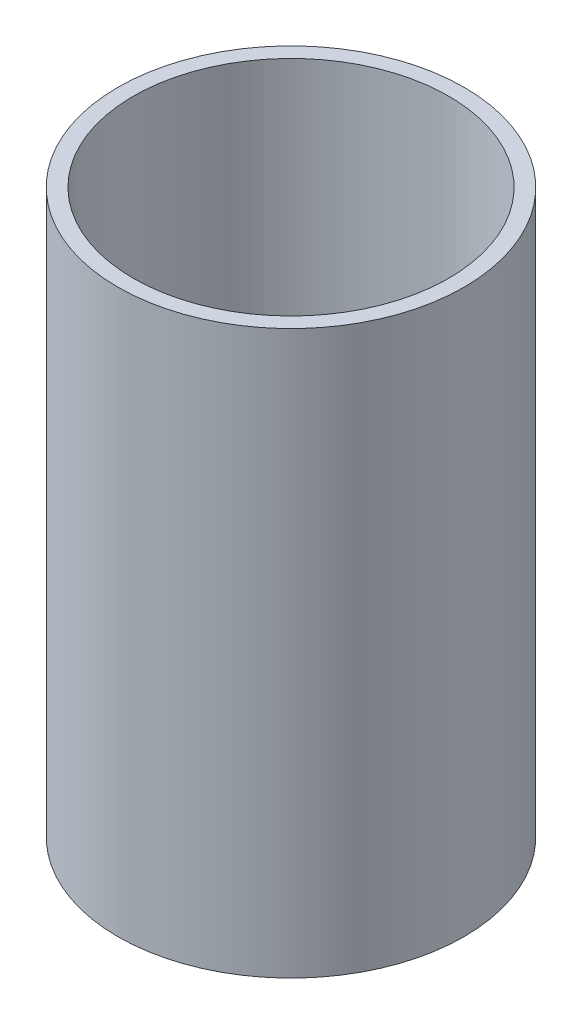
from build123d import *

# Parameters (mm, degrees)
SKETCH1_R           = 52.5
BOSS_EXTRUDE1_DEPTH = 170.59343656
SKETCH2_R           = 47.838914209
CUT_EXTRUDE1_DEPTH  = 187.050048636


with BuildPart() as part:
    # Sketch1 → Boss-Extrude1 (new body)
    with BuildSketch(Plane(origin=(0, 0, 0), x_dir=(1, 0, 0), z_dir=(0, 1, 0))):
        Circle(SKETCH1_R)
    extrude(amount=BOSS_EXTRUDE1_DEPTH)

    # Sketch2 → Cut-Extrude1 (cut, through all)
    with BuildSketch(Plane(origin=(0, 0, 0), x_dir=(1, 0, 0), z_dir=(0, 1, 0))):
        Circle(SKETCH2_R)
    extrude(amount=CUT_EXTRUDE1_DEPTH, mode=Mode.SUBTRACT)


solid = part.part
